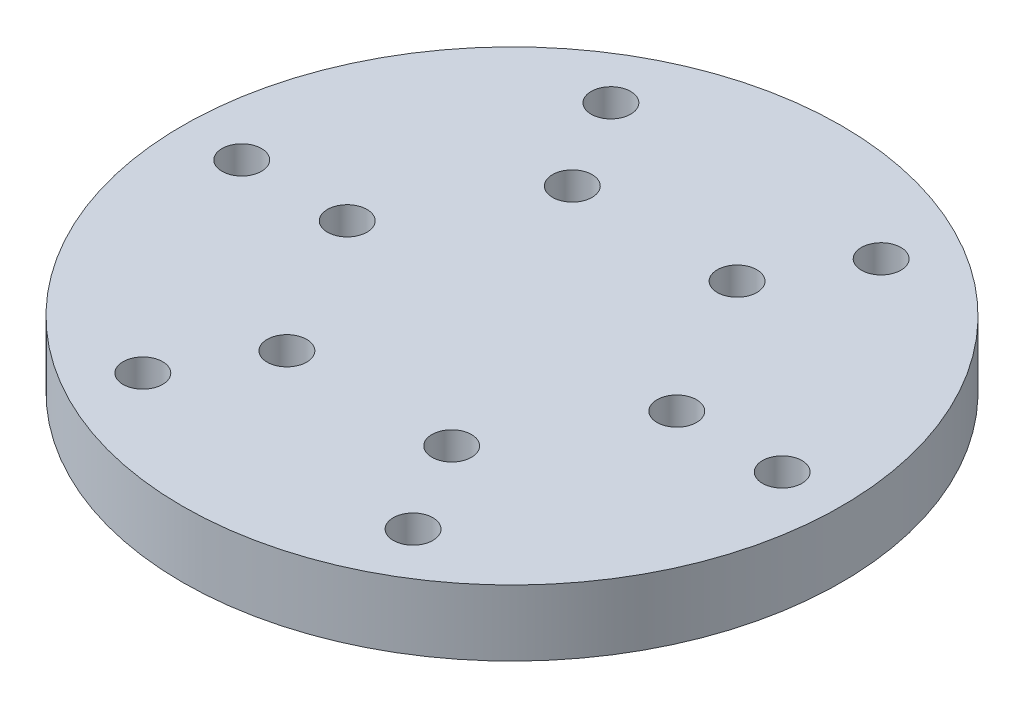
from build123d import *

# Parameters (mm, degrees)
SKETCH1_R           = 25
SKETCH1_R_2         = 1.5
BOSS_EXTRUDE1_DEPTH = 5


with BuildPart() as part:
    # Sketch1 → Boss-Extrude1 (new body)
    with BuildSketch(Plane(origin=(0, 0, 0), x_dir=(1, 0, 0), z_dir=(0, 1, 0))):
        with Locations((12.5, 0)):
            Circle(SKETCH1_R)
        with Locations((2.25, -17.753520778)):
            Circle(SKETCH1_R_2, mode=Mode.SUBTRACT)
        with Locations((6.25, -10.825317547)):
            Circle(SKETCH1_R_2, mode=Mode.SUBTRACT)
        Circle(SKETCH1_R_2, mode=Mode.SUBTRACT)
        with Locations((22.75, -17.753520778)):
            Circle(SKETCH1_R_2, mode=Mode.SUBTRACT)
        with Locations((18.75, -10.825317547)):
            Circle(SKETCH1_R_2, mode=Mode.SUBTRACT)
        with Locations((-8, 0)):
            Circle(SKETCH1_R_2, mode=Mode.SUBTRACT)
        with Locations((6.25, 10.825317547)):
            Circle(SKETCH1_R_2, mode=Mode.SUBTRACT)
        with Locations((2.25, 17.753520778)):
            Circle(SKETCH1_R_2, mode=Mode.SUBTRACT)
        with Locations((18.75, 10.825317547)):
            Circle(SKETCH1_R_2, mode=Mode.SUBTRACT)
        with Locations((25, 0)):
            Circle(SKETCH1_R_2, mode=Mode.SUBTRACT)
        with Locations((33, 0)):
            Circle(SKETCH1_R_2, mode=Mode.SUBTRACT)
        with Locations((22.75, 17.753520778)):
            Circle(SKETCH1_R_2, mode=Mode.SUBTRACT)
    extrude(amount=BOSS_EXTRUDE1_DEPTH)


solid = part.part
